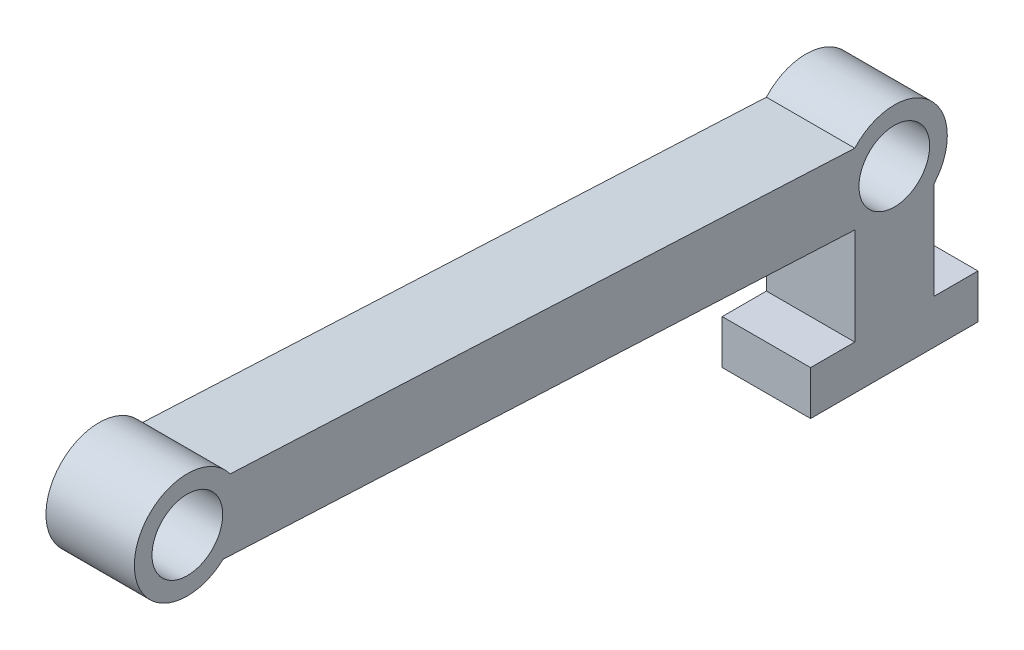
from build123d import *

# Parameters (mm, degrees)
LINKFRAME_R         = 40
BOSS_EXTRUDE1_DEPTH = 100


with BuildPart() as part:
    # LinkFrame → Boss-Extrude1 (new body)
    with BuildSketch(Plane(origin=(0, 0, 0), x_dir=(0, 0, -1), z_dir=(1, 0, 0))):
        with BuildLine():
            Line((-490.156154299, -141.822622041), (216.746524862, -176.043560924))
            ThreePointArc((216.746524862, -176.043560924), (301.467884412, -171.322201374), (306.189243962, -256.043560924))
            Line((306.189243962, -256.043560924), (306.189243962, -366.043560924))
            Line((306.189243962, -366.043560924), (356.189243962, -366.043560924))
            Line((356.189243962, -366.043560924), (356.189243962, -416.043560924))
            Line((356.189243962, -416.043560924), (166.746524862, -416.043560924))
            Line((166.746524862, -416.043560924), (166.746524862, -366.043560924))
            Line((166.746524862, -366.043560924), (216.746524862, -366.043560924))
            Line((216.746524862, -366.043560924), (216.746524862, -256.137245988))
            Line((216.746524862, -256.137245988), (-497.980433667, -221.537536174))
            ThreePointArc((-497.980433667, -221.537536174), (-598.24516538, -171.45477868), (-490.156154299, -141.822622041))
        make_face()
        with Locations((-538.532115588, -177.315809688)):
            Circle(LINKFRAME_R, mode=Mode.SUBTRACT)
        with Locations((261.467884412, -216.043560924)):
            Circle(LINKFRAME_R, mode=Mode.SUBTRACT)
    extrude(amount=BOSS_EXTRUDE1_DEPTH)


solid = part.part
